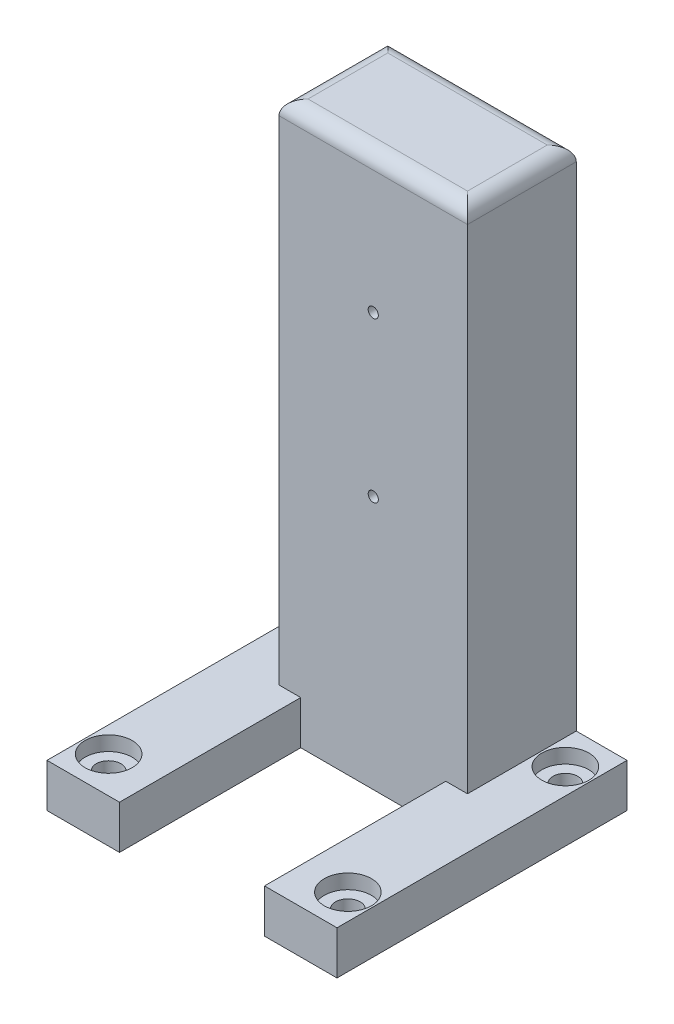
from build123d import *

# Parameters (mm, degrees)
BOSS_EXTRU_1_DEPTH                                   = 15
ESQUISSE2_W                                          = 10
ESQUISSE2_H                                          = 25
BOSS_EXTRU_2_DEPTH                                   = 6
D_GAGEMENT_M1_21_D                                   = 1.4
CHAMBRAGE_POUR_T_TE_CYLINDRIQUE_FENDUE_M_D           = 3.4
CHAMBRAGE_POUR_T_TE_CYLINDRIQUE_FENDUE_M_CBORE_D     = 6.5
CHAMBRAGE_POUR_T_TE_CYLINDRIQUE_FENDUE_M_CBORE_DEPTH = 2
CONG_1_R                                             = 2


with BuildPart() as part:
    # Esquisse1 → Boss.-Extru.1 (new body)
    with BuildSketch(Plane.XY):
        Polygon((0, 0), (-20, 0), (-20, 6), (-13, 6), (-13, 76), (13, 76), (13, 6), (20, 6), (20, 0), align=None)
    extrude(amount=BOSS_EXTRU_1_DEPTH)

    # Esquisse2 → Boss.-Extru.2 (add)
    with BuildSketch(Plane.XZ):
        with Locations((-15, 27.5)):
            Rectangle(ESQUISSE2_W, ESQUISSE2_H)
        with Locations((15, 27.5)):
            Rectangle(ESQUISSE2_W, ESQUISSE2_H)
    extrude(amount=-BOSS_EXTRU_2_DEPTH)

    # Dégagement M1.21 (through all)
    with Locations(Plane.XY.offset(15)):
        with Locations((0, 57), (0, 35)):
            Hole(D_GAGEMENT_M1_21_D / 2)

    # Chambrage pour tête cylindrique fendue M31 (through all)
    with Locations(Plane(origin=(0, 6, 0), x_dir=(1, 0, 0), z_dir=(0, 1, 0))):
        with Locations((-16.5, -5), (16.5, -5), (16.5, -35), (-16.5, -35)):
            CounterBoreHole(CHAMBRAGE_POUR_T_TE_CYLINDRIQUE_FENDUE_M_D / 2, CHAMBRAGE_POUR_T_TE_CYLINDRIQUE_FENDUE_M_CBORE_D / 2, CHAMBRAGE_POUR_T_TE_CYLINDRIQUE_FENDUE_M_CBORE_DEPTH)

    # Congé1
    cong_1_edges = [part.edges().sort_by_distance(p)[0] for p in [
        (13, 76, 7.5),
        (0, 76, 15),
        (-13, 76, 7.5),
        (0, 76, 0),
    ]]
    fillet(cong_1_edges, radius=CONG_1_R)


solid = part.part
